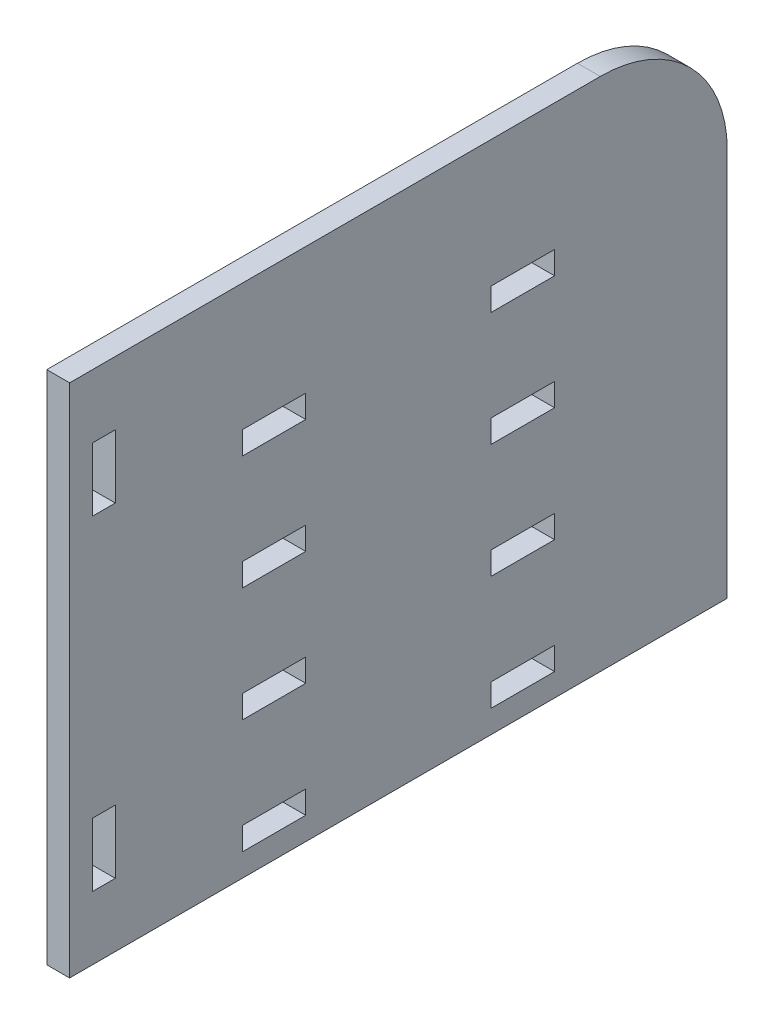
from build123d import *

# Parameters (mm, degrees)
SKETCH1_W           = 18
SKETCH1_H           = 50
SKETCH1_W_2         = 50
SKETCH1_H_2         = 18
BOSS_EXTRUDE1_DEPTH = 18


with BuildPart() as part:
    # Sketch1 → Boss-Extrude1 (new body)
    with BuildSketch(Plane(origin=(0, 0, 0), x_dir=(0, 0, -1), z_dir=(1, 0, 0))):
        with BuildLine():
            Line((-414.831767264, 57.151199882), (3.168232736, 57.151199882))
            ThreePointArc((3.168232736, 57.151199882), (73.878910855, 27.861878001), (103.168232736, -42.848800118))
            Line((103.168232736, -42.848800118), (103.168232736, -348.848800118))
            Line((103.168232736, -348.848800118), (-414.831767264, -348.848800118))
            Line((-414.831767264, -348.848800118), (-414.831767264, 57.151199882))
        make_face()
        with Locations((-387.831767264, -17.848800118)):
            Rectangle(SKETCH1_W, SKETCH1_H, mode=Mode.SUBTRACT)
        with Locations((-387.831767264, -273.848800118)):
            Rectangle(SKETCH1_W, SKETCH1_H, mode=Mode.SUBTRACT)
        with Locations((-253.831767264, -321.848800118)):
            Rectangle(SKETCH1_W_2, SKETCH1_H_2, mode=Mode.SUBTRACT)
        with Locations((-57.831767264, -321.848800118)):
            Rectangle(SKETCH1_W_2, SKETCH1_H_2, mode=Mode.SUBTRACT)
        with Locations((-253.831767264, -231.848800118)):
            Rectangle(SKETCH1_W_2, SKETCH1_H_2, mode=Mode.SUBTRACT)
        with Locations((-57.831767264, -231.848800118)):
            Rectangle(SKETCH1_W_2, SKETCH1_H_2, mode=Mode.SUBTRACT)
        with Locations((-253.831767264, -141.848800118)):
            Rectangle(SKETCH1_W_2, SKETCH1_H_2, mode=Mode.SUBTRACT)
        with Locations((-57.831767264, -141.848800118)):
            Rectangle(SKETCH1_W_2, SKETCH1_H_2, mode=Mode.SUBTRACT)
        with Locations((-253.831767264, -51.848800118)):
            Rectangle(SKETCH1_W_2, SKETCH1_H_2, mode=Mode.SUBTRACT)
        with Locations((-57.831767264, -51.848800118)):
            Rectangle(SKETCH1_W_2, SKETCH1_H_2, mode=Mode.SUBTRACT)
    extrude(amount=BOSS_EXTRUDE1_DEPTH)


solid = part.part
